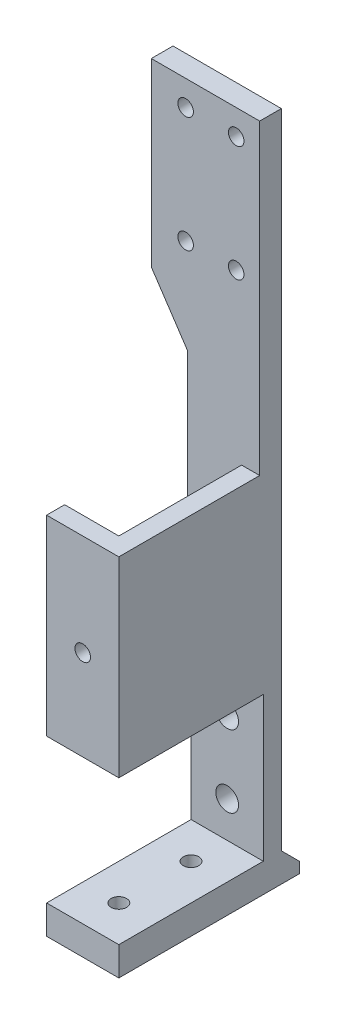
from build123d import *

# Parameters (mm, degrees)
SKETCH_1_W               = 35
SKETCH_1_H               = 80
SKETCH_1_R               = 2.15
EXTRUDE_1_DEPTH          = 30
SKETCH_3_W               = 35
SKETCH_3_H               = 5
EXTRUDE_2_DEPTH          = 40
SKETCH_4_W               = 40
SKETCH_4_H               = 22
SKETCH_4_W_2             = 30
SKETCH_4_H_2             = 20
CUT_EXTRUDE_2_DEPTH      = 70
CHAMFER_1_SIZE           = 5
SKETCH_7_R               = 3.15
CUT_EXTRUDE_3_DEPTH      = 70
CUT_EXTRUDE_4_DEPTH      = 70
SKETCH_9_R               = 2.15
EXTRUDE_3_DEPTH          = 8
EXTRUDE_4_DEPTH          = 35
CUT_EXTRUDE_5_DEPTH      = 154.300358773
CUT_EXTRUDE_5_DEPTH_BACK = 154.300358773
SKETCH_2_R               = 4.1
CUT_EXTRUDE_6_DEPTH      = 179.776396652
CUT_EXTRUDE_6_DEPTH_BACK = 179.776396652
SKETCH_11_W              = 15
SKETCH_11_H              = 156
SKETCH_13_W              = 40
SKETCH_13_H              = 22
CUT_EXTRUDE_7_DEPTH      = 177.453960001
SKETCH_19_W              = 45.998360267
SKETCH_19_H              = 78
CUT_EXTRUDE_11_DEPTH     = 56
SKETCH_21_R              = 2.15
EXTRUDE_8_DEPTH          = 6
SKETCH_22_W              = 39
SKETCH_22_H              = 45
EXTRUDE_9_DEPTH          = 5
SKETCH_23_W              = 20
SKETCH_23_H              = 53
SKETCH_23_R              = 2.15
EXTRUDE_10_DEPTH         = 5


with BuildPart() as part:
    # 草图1 → 凸台-拉伸1 (new body)
    with BuildSketch(Plane(origin=(0, 0, 0), x_dir=(1, 0, 0), z_dir=(0, 1, 0))):
        with Locations((17.5, 40)):
            Rectangle(SKETCH_1_W, SKETCH_1_H)
        with Locations(Location((25, 30, 0), (0, 0, 270))):
            Circle(SKETCH_1_R, mode=Mode.SUBTRACT)
        with Locations(Location((25, 10, 0), (0, 0, 270))):
            Circle(SKETCH_1_R, mode=Mode.SUBTRACT)
    extrude(amount=EXTRUDE_1_DEPTH)

    # 草图3 → 凸台-拉伸2 (add)
    with BuildSketch(Plane(origin=(0, 30, 0), x_dir=(1, 0, 0), z_dir=(0, 1, 0))):
        with Locations((17.5, 42.5)):
            Rectangle(SKETCH_3_W, SKETCH_3_H)
    extrude(amount=EXTRUDE_2_DEPTH)

    # 草图4 → 切除-拉伸2 (cut)
    with BuildSketch(Plane.ZY):
        with Locations((-20, 11)):
            Rectangle(SKETCH_4_W, SKETCH_4_H)
        with Locations((-65, 20)):
            Rectangle(SKETCH_4_W_2, SKETCH_4_H_2)
    extrude(amount=-CUT_EXTRUDE_2_DEPTH, mode=Mode.SUBTRACT)

    # 倒角1
    chamfer_1_edges = [part.edges().sort_by_distance(p)[0] for p in [
        (17.5, 30, -50),
    ]]
    chamfer(chamfer_1_edges, length=CHAMFER_1_SIZE - 0.0001)  # a hair under: the kernel refuses the full size

    # 草图7 → 切除-拉伸3 (cut)
    with BuildSketch(Plane(origin=(0, 0, -45), x_dir=(-1, 0, 0), z_dir=(0, 0, -1))):
        with Locations((-25, 60)):
            Circle(SKETCH_7_R)
        with Locations((-25, 40)):
            Circle(SKETCH_7_R)
    extrude(amount=-CUT_EXTRUDE_3_DEPTH, mode=Mode.SUBTRACT)

    # 草图8 → 切除-拉伸4 (cut)
    with BuildSketch(Plane(origin=(0, 30, 0), x_dir=(1, 0, 0), z_dir=(0, 1, 0))):
        Polygon((0, 0), (15, 0), (0, 36), align=None)
    extrude(amount=-CUT_EXTRUDE_4_DEPTH, mode=Mode.SUBTRACT)

    # 草图9 → 凸台-拉伸3 (add)
    with BuildSketch(Plane(origin=(0, 70, 0), x_dir=(1, 0, 0), z_dir=(0, 1, 0))):
        Polygon((35, 45), (0, 45), (0, 36), (15, 0), (35, 0), align=None)
        with Locations(Location((25, 30, 0), (0, 0, 270))):
            Circle(SKETCH_9_R, mode=Mode.SUBTRACT)
        with Locations(Location((25, 10, 0), (0, 0, 270))):
            Circle(SKETCH_9_R, mode=Mode.SUBTRACT)
    extrude(amount=EXTRUDE_3_DEPTH)

    # 草图10 → 凸台-拉伸4 (add, through all)
    with BuildSketch(Plane.ZY):
        Polygon((-40, 156), (-80, 156), (-80, 146), (-50, 146), (-50, 131), (-45, 126), (-45, 78), (-40.5, 78), align=None)
    extrude(amount=-EXTRUDE_4_DEPTH)

    # 草图2 → 切除-拉伸5 (cut, two sides: drawn at the far end of the back side and taken through both)
    with BuildSketch(Plane(origin=(0, 30, 0), x_dir=(1, 0, 0), z_dir=(0, 1, 0)).offset(-CUT_EXTRUDE_5_DEPTH_BACK)):
        with Locations(Location((10, 70, 0), (0, 0, 270))):
            Circle(SKETCH_2_R)
    extrude(amount=CUT_EXTRUDE_5_DEPTH + CUT_EXTRUDE_5_DEPTH_BACK, mode=Mode.SUBTRACT)

    # 草图11 → 切除-拉伸6 (cut, two sides: drawn at the far end of the back side and taken through both)
    with BuildSketch(Plane.XY.offset(-CUT_EXTRUDE_6_DEPTH_BACK)):
        with Locations((7.5, 78)):
            Rectangle(SKETCH_11_W, SKETCH_11_H)
    extrude(amount=CUT_EXTRUDE_6_DEPTH + CUT_EXTRUDE_6_DEPTH_BACK, mode=Mode.SUBTRACT)

    # 草图13 → 切除-拉伸7 (cut, through all)
    with BuildSketch(Plane(origin=(35, 0, 0), x_dir=(0, 0, -1), z_dir=(1, 0, 0))):
        with Locations((60, 11)):
            Rectangle(SKETCH_13_W, SKETCH_13_H)
    extrude(amount=-CUT_EXTRUDE_7_DEPTH, mode=Mode.SUBTRACT)

    # 草图19 → 切除-拉伸11 (cut)
    with BuildSketch(Plane.ZY.offset(-15)):
        with Locations((-57.000819867, 117)):
            Rectangle(SKETCH_19_W, SKETCH_19_H)
    extrude(amount=-CUT_EXTRUDE_11_DEPTH, mode=Mode.SUBTRACT)

    # 草图21 → 凸台-拉伸8 (add)
    with BuildSketch(Plane(origin=(0, 0, -45), x_dir=(-1, 0, 0), z_dir=(0, 0, -1))):
        Polygon((-35, 78), (-35, 208), (-5, 208), (-5, 158), (-15, 143), (-15, 78), align=None)
        with Locations((-28.5, 201)):
            Circle(SKETCH_21_R, mode=Mode.SUBTRACT)
        with Locations((-14.5, 201)):
            Circle(SKETCH_21_R, mode=Mode.SUBTRACT)
        with Locations((-28.5, 169)):
            Circle(SKETCH_21_R, mode=Mode.SUBTRACT)
        with Locations((-14.5, 169)):
            Circle(SKETCH_21_R, mode=Mode.SUBTRACT)
    extrude(amount=-EXTRUDE_8_DEPTH)

    # 草图22 → 凸台-拉伸9 (add)
    with BuildSketch(Plane(origin=(35, 0, 0), x_dir=(0, 0, -1), z_dir=(1, 0, 0))):
        with Locations((19.5, 100.5)):
            Rectangle(SKETCH_22_W, SKETCH_22_H)
    extrude(amount=-EXTRUDE_9_DEPTH)

    # 草图23 → 凸台-拉伸10 (add)
    with BuildSketch(Plane.XY):
        with Locations((25, 96.5)):
            Rectangle(SKETCH_23_W, SKETCH_23_H)
        with Locations((25, 95)):
            Circle(SKETCH_23_R, mode=Mode.SUBTRACT)
    extrude(amount=-EXTRUDE_10_DEPTH)


solid = part.part
